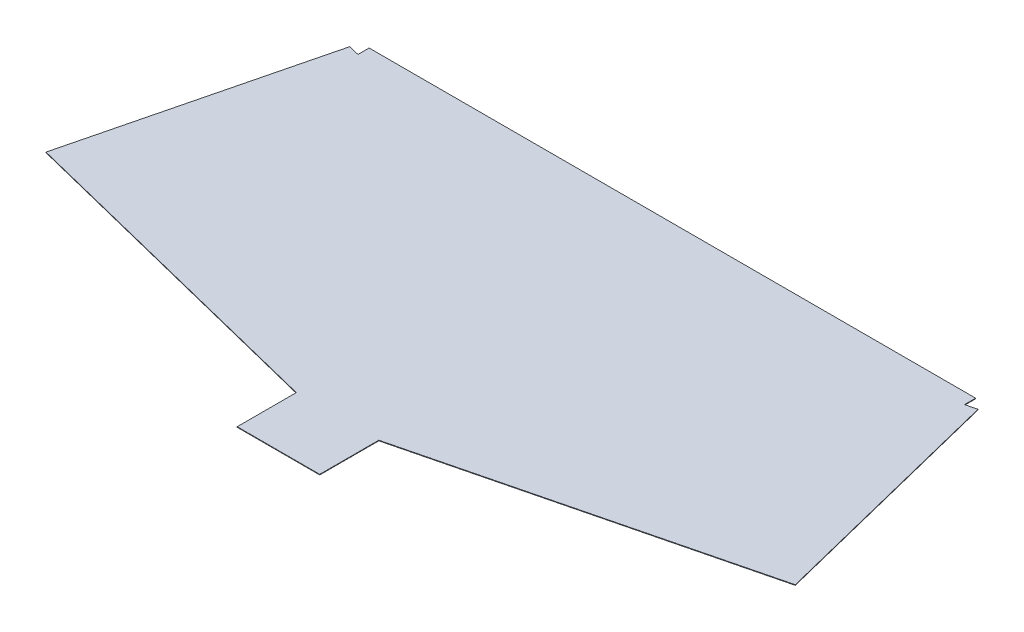
from build123d import *

# Parameters (mm, degrees)
BOSS_EXTRUDE1_DEPTH = 1


with BuildPart() as part:
    # Sketch1 → Boss-Extrude1 (new body)
    with BuildSketch(Plane(origin=(0, 0, 0), x_dir=(1, 0, 0), z_dir=(0, 1, 0))):
        Polygon((-1010.999168863, -375.483559699), (-432.309741609, -519.73309486), (-432.309741609, -625.73309486), (-284.309741609, -625.73309486), (-284.309741609, -519.73309486), (294.379685644, -375.483559699), (313.786824034, -370.650033087), (205.097396781, 65.749913711), (185.690258391, 60.9163871), (185.690258391, 80.9163871), (-902.309741609, 80.9163871), (-902.309741609, 60.9163871), (-921.71688, 65.749913711), (-1030.406307253, -370.650033087), align=None)
    extrude(amount=BOSS_EXTRUDE1_DEPTH)


solid = part.part
